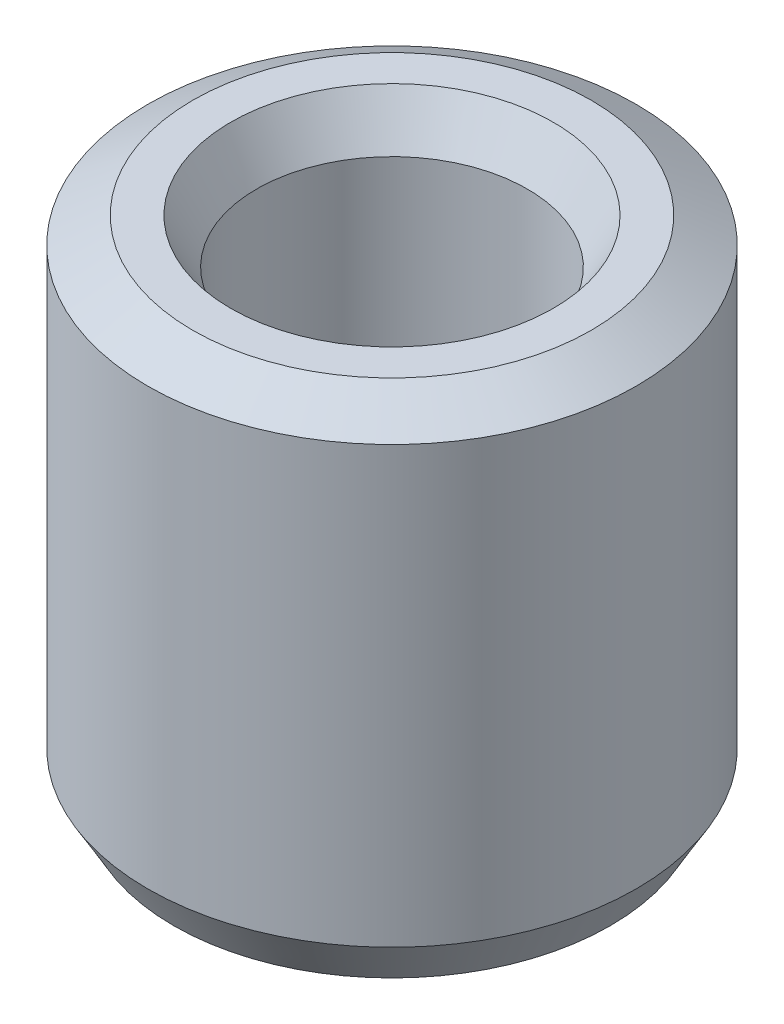
from build123d import *
from OCP.BRepFilletAPI import BRepFilletAPI_MakeChamfer

# Parameters (mm, degrees)
SKETCH1_R           = 37.5
BOSS_EXTRUDE1_DEPTH = 77.749401215
SKETCH2_R           = 20.790035593
CUT_EXTRUDE1_DEPTH  = 95.114129594
CHAMFER1_SIZE       = 3.981367447
CHAMFER1_SIZE2      = 6.895930702


with BuildPart() as part:
    # Sketch1 → Boss-Extrude1 (new body)
    with BuildSketch(Plane(origin=(0, 0, 0), x_dir=(1, 0, 0), z_dir=(0, 1, 0))):
        Circle(SKETCH1_R)
    extrude(amount=BOSS_EXTRUDE1_DEPTH)

    # Sketch2 → Cut-Extrude1 (cut, through all)
    with BuildSketch(Plane(origin=(0, 0, 0), x_dir=(1, 0, 0), z_dir=(0, 1, 0))):
        Circle(SKETCH2_R)
    extrude(amount=CUT_EXTRUDE1_DEPTH, mode=Mode.SUBTRACT)

    # Chamfer1: one chamfer whose edges measure the first distance from different faces: ONE call of the kernel's chamfer builder (chamfer() names one face for all edges)
    chamfer1_edges_1 = [part.edges().sort_by_distance(p)[0] for p in [
        (-20.790035593, 77.749401215, 0),
    ]]
    chamfer1_side_1 = [part.faces().sort_by_distance(p)[0] for p in [
        (-36.439339828, 77.749401215, 0),
    ]]
    chamfer1_edges_2 = [part.edges().sort_by_distance(p)[0] for p in [
        (-20.790035593, 0, 0),
    ]]
    chamfer1_side_2 = [part.faces().sort_by_distance(p)[0] for p in [
        (-20.790035593, 38.874700607, 0),
    ]]
    chamfer1_edges_3 = [part.edges().sort_by_distance(p)[0] for p in [
        (-37.5, 0, 0),
    ]]
    chamfer1_side_3 = [part.faces().sort_by_distance(p)[0] for p in [
        (-36.439339828, 0, 0),
    ]]
    chamfer1_edges_4 = [part.edges().sort_by_distance(p)[0] for p in [
        (-37.5, 77.749401215, 0),
    ]]
    chamfer1_side_4 = [part.faces().sort_by_distance(p)[0] for p in [
        (-37.5, 38.874700607, 0),
    ]]
    chamfer1 = BRepFilletAPI_MakeChamfer(part.part.solid().wrapped)
    for e in chamfer1_edges_1:
        chamfer1.Add(CHAMFER1_SIZE, CHAMFER1_SIZE2, e.wrapped, chamfer1_side_1[0].wrapped)  # the first distance lies on this face
    for e in chamfer1_edges_2:
        chamfer1.Add(CHAMFER1_SIZE, CHAMFER1_SIZE2, e.wrapped, chamfer1_side_2[0].wrapped)  # the first distance lies on this face
    for e in chamfer1_edges_3:
        chamfer1.Add(CHAMFER1_SIZE, CHAMFER1_SIZE2, e.wrapped, chamfer1_side_3[0].wrapped)  # the first distance lies on this face
    for e in chamfer1_edges_4:
        chamfer1.Add(CHAMFER1_SIZE, CHAMFER1_SIZE2, e.wrapped, chamfer1_side_4[0].wrapped)  # the first distance lies on this face
    add(Compound.cast(chamfer1.Shape()), mode=Mode.REPLACE)


solid = part.part
